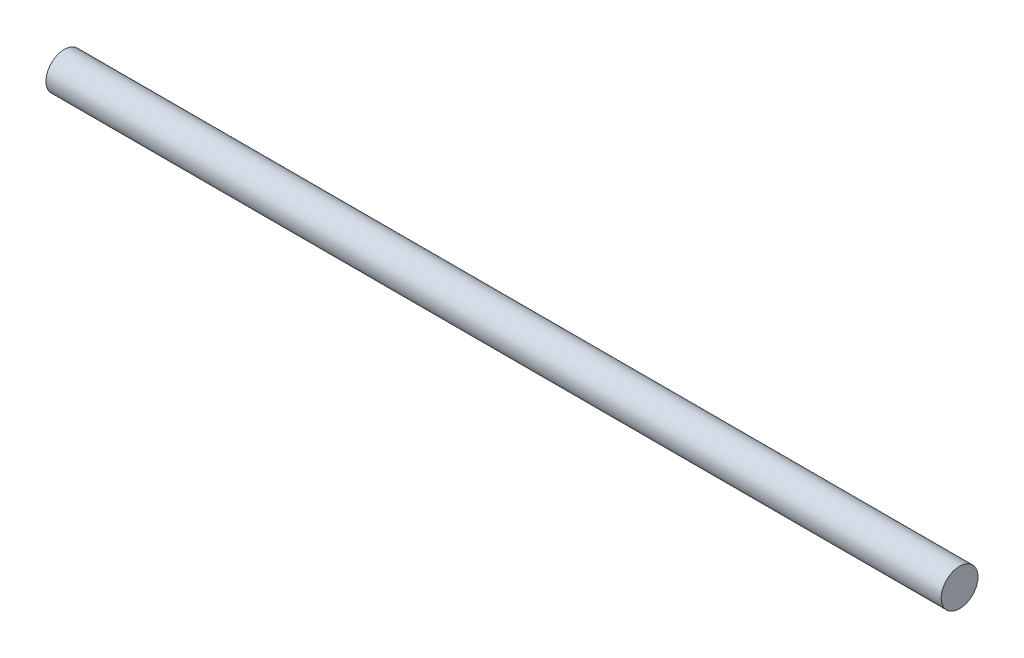
from build123d import *

# Parameters (mm, degrees)
SKETCH_1_R      = 3
EXTRUDE_1_DEPTH = 146


with BuildPart() as part:
    # 草图1 → 凸台-拉伸1 (new body)
    with BuildSketch(Plane(origin=(0, 0, 0), x_dir=(0, 0, -1), z_dir=(1, 0, 0))):
        Circle(SKETCH_1_R)
    extrude(amount=EXTRUDE_1_DEPTH)


solid = part.part
